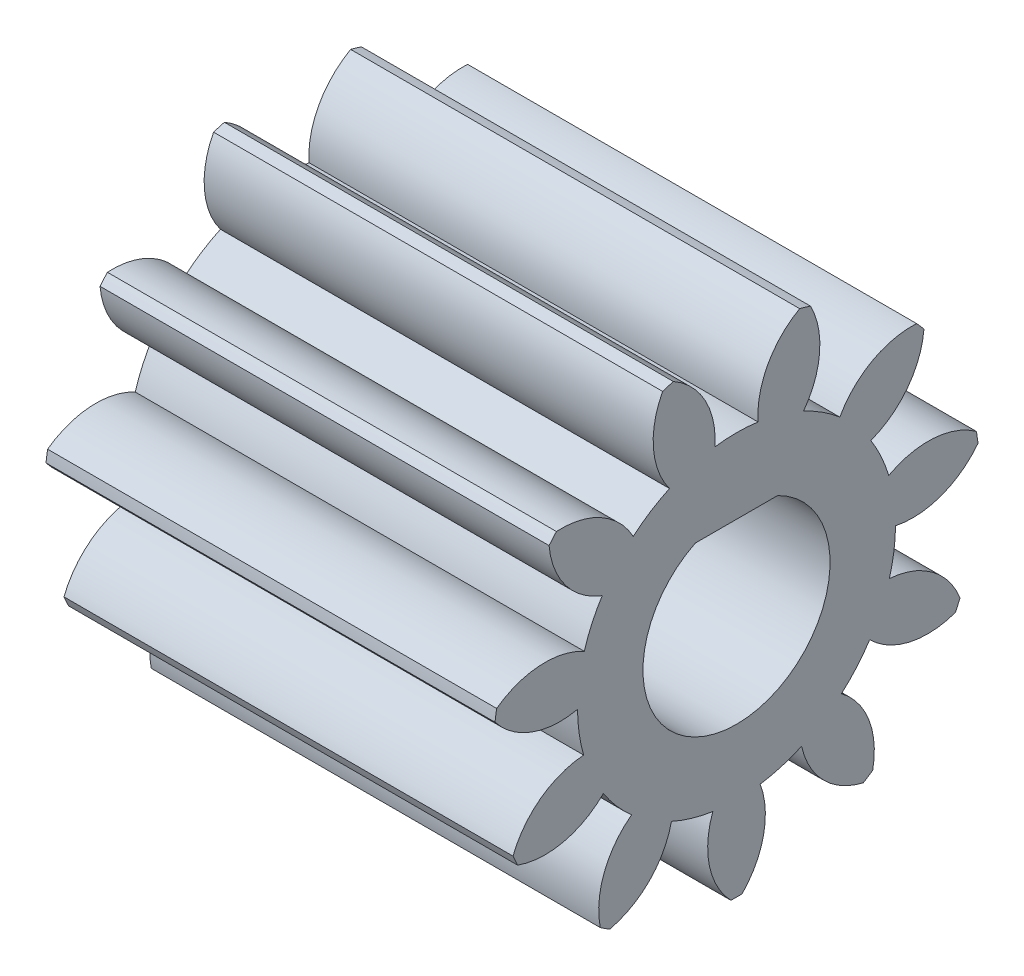
from build123d import *

# Parameters (mm, degrees)
BASPROSKE_W         = 12
BASPROSKE_H         = 6.5
TOOTHCUT_DEPTH      = 16.116216458
TEETHCUTS_COUNT     = 11
TEETHCUTS_ANGLE     = 327.272727273
BORSKE_R            = 2.5
BORE_DEPTH          = 50.0000508
BOSS_EXTRUDE1_DEPTH = 12


with BuildPart() as part:
    # BasProSke → Base-Revolve (revolve)
    with BuildSketch(Plane(origin=(0, 0, 0), x_dir=(1, 0, 0), z_dir=(0, 1, 0))):
        with Locations((6, 3.25)):
            Rectangle(BASPROSKE_W, BASPROSKE_H)
    revolve(axis=Axis((-10, 0, 0), (1, 0, 0)))

    # TooCutSke → ToothCut (cut, through all)
    with BuildSketch(Plane(origin=(0, 0, 0), x_dir=(0, 0, -1), z_dir=(1, 0, 0))):
        with BuildLine():
            ThreePointArc((0.576045815, 4.209771041), (0, 4.249), (-0.576045815, 4.209771041))
            ThreePointArc((-0.576045815, 4.209771041), (-0.841371334, 5.420048739), (-1.718652745, 6.295004202))
            ThreePointArc((-1.718652745, 6.295004202), (0, 6.5254), (1.718652745, 6.295004202))
            ThreePointArc((1.718652745, 6.295004202), (0.841371334, 5.420048739), (0.576045815, 4.209771041))
        make_face()
    toothcut = extrude(amount=TOOTHCUT_DEPTH, mode=Mode.SUBTRACT)

    # TeethCuts: ToothCut ×11 about axis
    teethcuts_axis = Axis((-10, 0, 0), (1, 0, 0))
    for i in range(1, TEETHCUTS_COUNT):
        add(toothcut.rotate(teethcuts_axis, i * TEETHCUTS_ANGLE / (TEETHCUTS_COUNT - 1)), mode=Mode.SUBTRACT)

    # BorSke → Bore (cut, symmetric)
    with BuildSketch(Plane(origin=(0, 0, 0), x_dir=(0, 0, -1), z_dir=(1, 0, 0))):
        Circle(BORSKE_R)
    extrude(amount=BORE_DEPTH, both=True, mode=Mode.SUBTRACT)

    # Sketch1 → Boss-Extrude1 (add)
    with BuildSketch(Plane(origin=(12, 0, 0), x_dir=(0, 0, -1), z_dir=(1, 0, 0))):
        with BuildLine():
            Line((-1.1, 2.244994432), (1.1, 2.244994432))
            ThreePointArc((1.1, 2.244994432), (0, 2.5), (-1.1, 2.244994432))
        make_face()
    extrude(amount=-BOSS_EXTRUDE1_DEPTH)


solid = part.part
